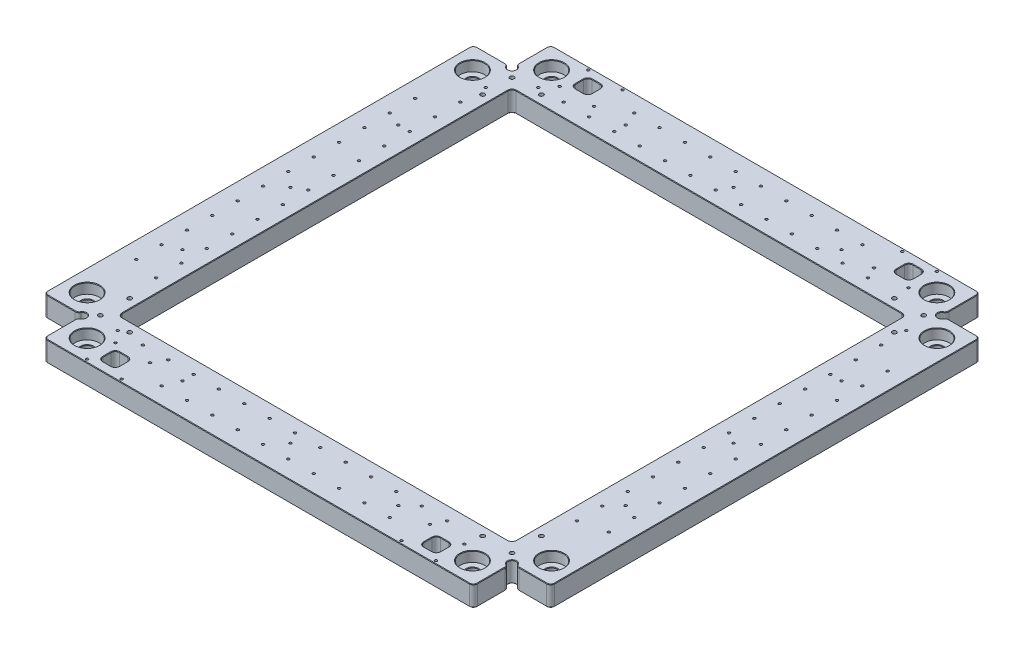
from build123d import *

# Parameters (mm, degrees)
SKETCH1_W                            = 500
SKETCH1_H                            = 500
BOSS_EXTRUDE1_DEPTH                  = 20
BEARING_PRESS_FIT_D                  = 11.8
CIRPATTERN1_COUNT                    = 4
SKETCH5_W                            = 388
SKETCH5_H                            = 388
CUT_EXTRUDE1_DEPTH                   = 20
SKETCH10_W                           = 428
SKETCH10_H                           = 428
SKETCH10_W_2                         = 403
SKETCH10_H_2                         = 403
LINEAR_RAIL_SLOT_DEPTH               = 2.5
FILLET2_R                            = 4
TAP_DRILL_FOR_M3X0_5_TAP1_D          = 2.5
MIRROR6_COPY_1_D                     = 2.5
BOSS_EXTRUDE2_DEPTH                  = 2.5
CIRPATTERN4_COUNT                    = 4
CUT_EXTRUDE3_DEPTH                   = 355.118624193
TAP_DRILL_FOR_M3X0_5_TAP6_D          = 2.5
MIRROR9_COPY_1_DEPTH                 = 355.118624193
MIRROR9_COPY_2_D                     = 2.5
SKETCH27_W                           = 38.1
SKETCH27_H                           = 38.1
CUT_EXTRUDE4_DEPTH                   = 20
SKETCH47_R                           = 4
CUT_EXTRUDE5_DEPTH                   = 20
TAP_DRILL_FOR_M5X0_8_TAP1_AT_2_COUNT = 2
TAP_DRILL_FOR_M5X0_8_TAP1_AT_2_PITCH = 29
TAP_DRILL_FOR_M5X0_8_TAP1_AT_3_COUNT = 2
TAP_DRILL_FOR_M5X0_8_TAP1_AT_3_PITCH = 41.012193309
TAP_DRILL_FOR_M3X0_5_TAP7_D          = 2.5
CUT_EXTRUDE6_DEPTH                   = 3.5
TAP_DRILL_FOR_M3X0_5_TAP9_D          = 2.5
LPATTERN1_COUNT                      = 3
LPATTERN1_PITCH                      = 106.5
CIRPATTERN3_COUNT                    = 4
CIRPATTERN3_COPY_7_DEPTH             = 3.5
CIRPATTERN3_COPY_8_DEPTH             = 3.5
CIRPATTERN3_COPY_9_DEPTH             = 3.5
CIRPATTERN3_COPY_10_DEPTH            = 3.5
CIRPATTERN3_COPY_11_DEPTH            = 3.5
CIRPATTERN3_COPY_12_DEPTH            = 3.5
CIRPATTERN3_COPY_13_D                = 2.5
CIRPATTERN3_COPY_14_D                = 2.5
CIRPATTERN3_COPY_15_D                = 2.5
CIRPATTERN3_COPY_16_D                = 2.5
CIRPATTERN3_COPY_17_D                = 2.5
CIRPATTERN3_COPY_18_D                = 2.5
FILLET8_R                            = 4
F_24_0_24_DIAMETER_HOLE1_D           = 24
F_24_0_24_DIAMETER_HOLE1_DEPTH       = 10
FILLET6_R                            = 4
TAP_DRILL_FOR_M3X0_5_TAP8_D          = 2.5
CHAMFER1_SIZE                        = 0.5


with BuildPart() as part:
    # Sketch1 → Boss-Extrude1 (new body)
    with BuildSketch(Plane(origin=(0, 0, 0), x_dir=(1, 0, 0), z_dir=(0, 1, 0))):
        Rectangle(SKETCH1_W, SKETCH1_H)
    extrude(amount=BOSS_EXTRUDE1_DEPTH)

    # Bearing Press Fit (through all)
    with Locations(Plane(origin=(0, 20, 0), x_dir=(1, 0, 0), z_dir=(0, 1, 0))):
        with Locations((-190, 229), (-229, 190)):
            bearing_press_fit = Hole(BEARING_PRESS_FIT_D / 2)

    # CirPattern1: Bearing Press Fit ×4 about axis
    cirpattern1_axis = Axis((0, 0, 0), (0, 1, 0))
    for i in range(1, CIRPATTERN1_COUNT):
        add(bearing_press_fit.rotate(cirpattern1_axis, i * 360 / CIRPATTERN1_COUNT), mode=Mode.SUBTRACT)

    # Sketch5 → Cut-Extrude1 (cut)
    with BuildSketch(Plane(origin=(0, 20, 0), x_dir=(1, 0, 0), z_dir=(0, 1, 0))):
        Rectangle(SKETCH5_W, SKETCH5_H)
    extrude(amount=-CUT_EXTRUDE1_DEPTH, mode=Mode.SUBTRACT)

    # Sketch10 → Linear Rail Slot (cut)
    with BuildSketch(Plane(origin=(0, 0, 0), x_dir=(1, 0, 0), z_dir=(0, 1, 0))):
        Rectangle(SKETCH10_W, SKETCH10_H)
        Rectangle(SKETCH10_W_2, SKETCH10_H_2, mode=Mode.SUBTRACT)
    extrude(amount=LINEAR_RAIL_SLOT_DEPTH, mode=Mode.SUBTRACT)

    # Fillet2
    fillet2_edges = [part.edges().sort_by_distance(p)[0] for p in [
        (-194, 10, 194),
        (-194, 10, -194),
        (194, 10, -194),
        (194, 10, 194),
    ]]
    fillet(fillet2_edges, radius=FILLET2_R)

    # Tap Drill for M3x0.5 Tap1 (through all)
    with Locations(Plane(origin=(0, 2.5, 0), x_dir=(-1, 0, 0), z_dir=(0, -1, 0))):
        with Locations((-143.5, -207.5), (-118.5, -207.5), (-93.5, -207.5), (-68.5, -207.5), (-43.5, -207.5), (-18.5, -207.5), (6.5, -207.5), (31.5, -207.5), (56.5, -207.5), (81.5, -207.5), (106.5, -207.5), (131.5, -207.5), (156.5, -207.5), (181.5, -207.5)):
            tap_drill_for_m3x0_5_tap1 = Hole(TAP_DRILL_FOR_M3X0_5_TAP1_D / 2)

    # Mirror5: Tap Drill for M3x0.5 Tap1 across plane
    add(tap_drill_for_m3x0_5_tap1.mirror(Plane.XY), mode=Mode.SUBTRACT)

    # Mirror6: Tap Drill for M3x0.5 Tap1 across plane
    add(tap_drill_for_m3x0_5_tap1.mirror(Plane(origin=(0, 0, 0), x_dir=(0.7071067811865478, 0, 0.7071067811865472), z_dir=(-0.7071067811865475, 0, 0.7071067811865477))), mode=Mode.SUBTRACT)

    # Mirror6 copy 1 (through all)
    with Locations(Plane(origin=(0, 2.5, 0), x_dir=(0, 0, -1), z_dir=(0, -1, 0))):
        with Locations((-143.5, -207.5), (-118.5, -207.5), (-93.5, -207.5), (-68.5, -207.5), (-43.5, -207.5), (-18.5, -207.5), (6.5, -207.5), (31.5, -207.5), (56.5, -207.5), (81.5, -207.5), (106.5, -207.5), (131.5, -207.5), (156.5, -207.5), (181.5, -207.5)):
            Hole(MIRROR6_COPY_1_D / 2)

    # Sketch19 → Boss-Extrude2 (add)
    with BuildSketch(Plane.XZ.offset(-2.5)):
        Polygon((-198.5, 201.5), (-198.5, 214), (-214, 214), (-214, 198.5), (-201.5, 198.5), (-201.5, 201.5), align=None)
    boss_extrude2 = extrude(amount=BOSS_EXTRUDE2_DEPTH)

    # CirPattern4: Boss-Extrude2 ×4 about axis
    cirpattern4_axis = Axis((0, 0, 0), (0, 1, 0))
    for i in range(1, CIRPATTERN4_COUNT):
        add(boss_extrude2.rotate(cirpattern4_axis, i * 360 / CIRPATTERN4_COUNT))

    # Sketch20 → Cut-Extrude3 (cut, through all)
    with BuildSketch(Plane(origin=(0, 20, 0), x_dir=(1, 0, 0), z_dir=(0, 1, 0))):
        with BuildLine():
            Line((162.3, -241), (154.3, -241))
            ThreePointArc((154.3, -241), (151.471572875, -239.828427125), (150.3, -237))
            Line((150.3, -237), (150.3, -229))
            ThreePointArc((150.3, -229), (151.471572875, -226.171572875), (154.3, -225))
            Line((154.3, -225), (162.3, -225))
            ThreePointArc((162.3, -225), (165.128427125, -226.171572875), (166.3, -229))
            Line((166.3, -229), (166.3, -237))
            ThreePointArc((166.3, -237), (165.128427125, -239.828427125), (162.3, -241))
        make_face()
    cut_extrude3 = extrude(amount=-CUT_EXTRUDE3_DEPTH, mode=Mode.SUBTRACT)

    # Tap Drill for M3x0.5 Tap6 (through all)
    with Locations(Plane(origin=(0, 20, 0), x_dir=(1, 0, 0), z_dir=(0, 1, 0))):
        with Locations((172, -247), (138, -219), (172, -219), (138, -247)):
            tap_drill_for_m3x0_5_tap6 = Hole(TAP_DRILL_FOR_M3X0_5_TAP6_D / 2)

    # Mirror8: Cut-Extrude3, Tap Drill for M3x0.5 Tap6 across plane
    add(cut_extrude3.mirror(Plane(origin=(0, 0, 0), x_dir=(0, 0, 1), z_dir=(1, 0, 0))), mode=Mode.SUBTRACT)
    add(tap_drill_for_m3x0_5_tap6.mirror(Plane(origin=(0, 0, 0), x_dir=(0, 0, 1), z_dir=(1, 0, 0))), mode=Mode.SUBTRACT)

    # Mirror9: Cut-Extrude3, Tap Drill for M3x0.5 Tap6 across plane
    add(cut_extrude3.mirror(Plane.XY), mode=Mode.SUBTRACT)
    add(tap_drill_for_m3x0_5_tap6.mirror(Plane.XY), mode=Mode.SUBTRACT)

    # Mirror9 copy 1 sketch → Mirror9 copy 1 (cut, through all)
    with BuildSketch(Plane(origin=(0, 20, 0), x_dir=(-1, 0, 0), z_dir=(0, 1, 0))):
        with BuildLine():
            Line((162.3, -241), (154.3, -241))
            ThreePointArc((154.3, -241), (151.471572875, -239.828427125), (150.3, -237))
            Line((150.3, -237), (150.3, -229))
            ThreePointArc((150.3, -229), (151.471572875, -226.171572875), (154.3, -225))
            Line((154.3, -225), (162.3, -225))
            ThreePointArc((162.3, -225), (165.128427125, -226.171572875), (166.3, -229))
            Line((166.3, -229), (166.3, -237))
            ThreePointArc((166.3, -237), (165.128427125, -239.828427125), (162.3, -241))
        make_face()
    extrude(amount=-MIRROR9_COPY_1_DEPTH, mode=Mode.SUBTRACT)

    # Mirror9 copy 2 (through all)
    with Locations(Plane(origin=(0, 20, 0), x_dir=(-1, 0, 0), z_dir=(0, 1, 0))):
        with Locations((172, -247), (138, -219), (172, -219), (138, -247)):
            Hole(MIRROR9_COPY_2_D / 2)

    # Sketch27 → Cut-Extrude4 (cut)
    with BuildSketch(Plane(origin=(0, 20, 0), x_dir=(1, 0, 0), z_dir=(0, 1, 0))):
        with Locations((230.95, -230.95)):
            Rectangle(SKETCH27_W, SKETCH27_H)
    cut_extrude4 = extrude(amount=-CUT_EXTRUDE4_DEPTH, mode=Mode.SUBTRACT)

    # Sketch47 → Cut-Extrude5 (cut)
    with BuildSketch(Plane.XZ):
        with Locations((211.9, 211.9)):
            Circle(SKETCH47_R)
    cut_extrude5 = extrude(amount=-CUT_EXTRUDE5_DEPTH, mode=Mode.SUBTRACT)

    # Sketch49 → Tap Drill for M5x0.8 Tap1 (revolve, cut)
    with BuildSketch(Plane(origin=(174, 20, 203), x_dir=(0, 0, 1), z_dir=(1, 0, 0))):
        Polygon((0, 0), (0, 11.2618073), (2.1, 10), (2.1, 0), align=None)
    tap_drill_for_m5x0_8_tap1 = revolve(axis=Axis((174, 26.35, 203), (0, -1, 0)), mode=Mode.SUBTRACT)

    # Tap Drill for M5x0.8 Tap1 at 2: Tap Drill for M5x0.8 Tap1 ×2
    with Locations(*[(i * TAP_DRILL_FOR_M5X0_8_TAP1_AT_2_PITCH, 0, 0) for i in range(1, TAP_DRILL_FOR_M5X0_8_TAP1_AT_2_COUNT)]):
        add(tap_drill_for_m5x0_8_tap1, mode=Mode.SUBTRACT)

    # Tap Drill for M5x0.8 Tap1 at 3: Tap Drill for M5x0.8 Tap1 ×2
    with Locations(*[Vector(0.7071067811865479, 0, -0.7071067811865472) * (i * TAP_DRILL_FOR_M5X0_8_TAP1_AT_3_PITCH) for i in range(1, TAP_DRILL_FOR_M5X0_8_TAP1_AT_3_COUNT)]):
        add(tap_drill_for_m5x0_8_tap1, mode=Mode.SUBTRACT)

    # Tap Drill for M3x0.5 Tap7 (through all)
    with Locations(Plane(origin=(0, 0, 0), x_dir=(-1, 0, 0), z_dir=(0, -1, 0))):
        with Locations((-112.5, -233), (-87.5, -233), (-62.5, -233), (-37.5, -233), (-12.5, -233), (12.5, -233), (37.5, -233), (62.5, -233), (87.5, -233), (112.5, -233)):
            tap_drill_for_m3x0_5_tap7 = Hole(TAP_DRILL_FOR_M3X0_5_TAP7_D / 2)

    # Sketch59 → Cut-Extrude6 (cut)
    with BuildSketch(Plane.XZ):
        with BuildLine():
            Line((-94, 213.5), (-119, 213.5))
            ThreePointArc((-119, 213.5), (-121.828427125, 214.671572875), (-123, 217.5))
            Line((-123, 217.5), (-123, 219.5))
            ThreePointArc((-123, 219.5), (-121.828427125, 222.328427125), (-119, 223.5))
            Line((-119, 223.5), (-94, 223.5))
            ThreePointArc((-94, 223.5), (-91.171572875, 222.328427125), (-90, 219.5))
            Line((-90, 219.5), (-90, 217.5))
            ThreePointArc((-90, 217.5), (-91.171572875, 214.671572875), (-94, 213.5))
        make_face()
    cut_extrude6 = extrude(amount=-CUT_EXTRUDE6_DEPTH, mode=Mode.SUBTRACT)

    # Tap Drill for M3x0.5 Tap9 (through all)
    with Locations(Plane(origin=(0, 3.5, 0), x_dir=(-1, 0, 0), z_dir=(0, -1, 0))):
        with Locations((106.5, -218.5)):
            tap_drill_for_m3x0_5_tap9 = Hole(TAP_DRILL_FOR_M3X0_5_TAP9_D / 2)

    # LPattern1: Cut-Extrude6, Tap Drill for M3x0.5 Tap9 ×3
    with Locations(*[(i * LPATTERN1_PITCH, 0, 0) for i in range(1, LPATTERN1_COUNT)]):
        add(cut_extrude6, mode=Mode.SUBTRACT)
        add(tap_drill_for_m3x0_5_tap9, mode=Mode.SUBTRACT)

    # CirPattern3: Cut-Extrude4, Cut-Extrude5, Tap Drill for M5x0.8 Tap1, Tap Drill for M3x0.5 Tap7, Cut-Extrude6, Tap Drill for M3x0.5 Tap9 ×4 about axis
    cirpattern3_axis = Axis((0, 0, 0), (0, 1, 0))
    add([cut_extrude4.rotate(cirpattern3_axis, i * 360 / CIRPATTERN3_COUNT) for i in range(1, CIRPATTERN3_COUNT)], mode=Mode.SUBTRACT)
    add([cut_extrude5.rotate(cirpattern3_axis, i * 360 / CIRPATTERN3_COUNT) for i in range(1, CIRPATTERN3_COUNT)], mode=Mode.SUBTRACT)
    add([tap_drill_for_m5x0_8_tap1.rotate(cirpattern3_axis, i * 360 / CIRPATTERN3_COUNT) for i in range(1, CIRPATTERN3_COUNT)], mode=Mode.SUBTRACT)
    add([tap_drill_for_m3x0_5_tap7.rotate(cirpattern3_axis, i * 360 / CIRPATTERN3_COUNT) for i in range(1, CIRPATTERN3_COUNT)], mode=Mode.SUBTRACT)
    add([cut_extrude6.rotate(cirpattern3_axis, i * 360 / CIRPATTERN3_COUNT) for i in range(1, CIRPATTERN3_COUNT)], mode=Mode.SUBTRACT)
    add([tap_drill_for_m3x0_5_tap9.rotate(cirpattern3_axis, i * 360 / CIRPATTERN3_COUNT) for i in range(1, CIRPATTERN3_COUNT)], mode=Mode.SUBTRACT)

    # CirPattern3 copy 1 sketch → CirPattern3 copy 1 (revolve, cut)
    with BuildSketch(Plane(origin=(203, 20, -203), x_dir=(1, 0, 0), z_dir=(0, 0, -1))):
        Polygon((0, 0), (0, 11.2618073), (2.1, 10), (2.1, 0), align=None)
    revolve(axis=Axis((203, 26.35, -203), (0, -1, 0)), mode=Mode.SUBTRACT)

    # CirPattern3 copy 2 sketch → CirPattern3 copy 2 (revolve, cut)
    with BuildSketch(Plane(origin=(-203, 20, -203), x_dir=(0, 0, -1), z_dir=(-1, 0, 0))):
        Polygon((0, 0), (0, 11.2618073), (2.1, 10), (2.1, 0), align=None)
    revolve(axis=Axis((-203, 26.35, -203), (0, -1, 0)), mode=Mode.SUBTRACT)

    # CirPattern3 copy 3 sketch → CirPattern3 copy 3 (revolve, cut)
    with BuildSketch(Plane(origin=(-203, 20, 203), x_dir=(-1, 0, 0), z_dir=(0, 0, 1))):
        Polygon((0, 0), (0, 11.2618073), (2.1, 10), (2.1, 0), align=None)
    revolve(axis=Axis((-203, 26.35, 203), (0, -1, 0)), mode=Mode.SUBTRACT)

    # CirPattern3 copy 4 sketch → CirPattern3 copy 4 (revolve, cut)
    with BuildSketch(Plane(origin=(174, 20, -203), x_dir=(1, 0, 0), z_dir=(0, 0, -1))):
        Polygon((0, 0), (0, 11.2618073), (2.1, 10), (2.1, 0), align=None)
    revolve(axis=Axis((174, 26.35, -203), (0, -1, 0)), mode=Mode.SUBTRACT)

    # CirPattern3 copy 5 sketch → CirPattern3 copy 5 (revolve, cut)
    with BuildSketch(Plane(origin=(-203, 20, -174), x_dir=(0, 0, -1), z_dir=(-1, 0, 0))):
        Polygon((0, 0), (0, 11.2618073), (2.1, 10), (2.1, 0), align=None)
    revolve(axis=Axis((-203, 26.35, -174), (0, -1, 0)), mode=Mode.SUBTRACT)

    # CirPattern3 copy 6 sketch → CirPattern3 copy 6 (revolve, cut)
    with BuildSketch(Plane(origin=(-174, 20, 203), x_dir=(-1, 0, 0), z_dir=(0, 0, 1))):
        Polygon((0, 0), (0, 11.2618073), (2.1, 10), (2.1, 0), align=None)
    revolve(axis=Axis((-174, 26.35, 203), (0, -1, 0)), mode=Mode.SUBTRACT)

    # CirPattern3 copy 7 sketch → CirPattern3 copy 7 (cut)
    with BuildSketch(Plane(origin=(0, 0, -106.5), x_dir=(0, 0, -1), z_dir=(0, -1, 0))):
        with BuildLine():
            Line((-94, 213.5), (-119, 213.5))
            ThreePointArc((-119, 213.5), (-121.828427125, 214.671572875), (-123, 217.5))
            Line((-123, 217.5), (-123, 219.5))
            ThreePointArc((-123, 219.5), (-121.828427125, 222.328427125), (-119, 223.5))
            Line((-119, 223.5), (-94, 223.5))
            ThreePointArc((-94, 223.5), (-91.171572875, 222.328427125), (-90, 219.5))
            Line((-90, 219.5), (-90, 217.5))
            ThreePointArc((-90, 217.5), (-91.171572875, 214.671572875), (-94, 213.5))
        make_face()
    extrude(amount=-CIRPATTERN3_COPY_7_DEPTH, mode=Mode.SUBTRACT)

    # CirPattern3 copy 8 sketch → CirPattern3 copy 8 (cut)
    with BuildSketch(Plane(origin=(-106.5, 0, 0), x_dir=(-1, 0, 0), z_dir=(0, -1, 0))):
        with BuildLine():
            Line((-94, 213.5), (-119, 213.5))
            ThreePointArc((-119, 213.5), (-121.828427125, 214.671572875), (-123, 217.5))
            Line((-123, 217.5), (-123, 219.5))
            ThreePointArc((-123, 219.5), (-121.828427125, 222.328427125), (-119, 223.5))
            Line((-119, 223.5), (-94, 223.5))
            ThreePointArc((-94, 223.5), (-91.171572875, 222.328427125), (-90, 219.5))
            Line((-90, 219.5), (-90, 217.5))
            ThreePointArc((-90, 217.5), (-91.171572875, 214.671572875), (-94, 213.5))
        make_face()
    extrude(amount=-CIRPATTERN3_COPY_8_DEPTH, mode=Mode.SUBTRACT)

    # CirPattern3 copy 9 sketch → CirPattern3 copy 9 (cut)
    with BuildSketch(Plane(origin=(0, 0, 106.5), x_dir=(0, 0, 1), z_dir=(0, -1, 0))):
        with BuildLine():
            Line((-94, 213.5), (-119, 213.5))
            ThreePointArc((-119, 213.5), (-121.828427125, 214.671572875), (-123, 217.5))
            Line((-123, 217.5), (-123, 219.5))
            ThreePointArc((-123, 219.5), (-121.828427125, 222.328427125), (-119, 223.5))
            Line((-119, 223.5), (-94, 223.5))
            ThreePointArc((-94, 223.5), (-91.171572875, 222.328427125), (-90, 219.5))
            Line((-90, 219.5), (-90, 217.5))
            ThreePointArc((-90, 217.5), (-91.171572875, 214.671572875), (-94, 213.5))
        make_face()
    extrude(amount=-CIRPATTERN3_COPY_9_DEPTH, mode=Mode.SUBTRACT)

    # CirPattern3 copy 10 sketch → CirPattern3 copy 10 (cut)
    with BuildSketch(Plane(origin=(0, 0, -213), x_dir=(0, 0, -1), z_dir=(0, -1, 0))):
        with BuildLine():
            Line((-94, 213.5), (-119, 213.5))
            ThreePointArc((-119, 213.5), (-121.828427125, 214.671572875), (-123, 217.5))
            Line((-123, 217.5), (-123, 219.5))
            ThreePointArc((-123, 219.5), (-121.828427125, 222.328427125), (-119, 223.5))
            Line((-119, 223.5), (-94, 223.5))
            ThreePointArc((-94, 223.5), (-91.171572875, 222.328427125), (-90, 219.5))
            Line((-90, 219.5), (-90, 217.5))
            ThreePointArc((-90, 217.5), (-91.171572875, 214.671572875), (-94, 213.5))
        make_face()
    extrude(amount=-CIRPATTERN3_COPY_10_DEPTH, mode=Mode.SUBTRACT)

    # CirPattern3 copy 11 sketch → CirPattern3 copy 11 (cut)
    with BuildSketch(Plane(origin=(-213, 0, 0), x_dir=(-1, 0, 0), z_dir=(0, -1, 0))):
        with BuildLine():
            Line((-94, 213.5), (-119, 213.5))
            ThreePointArc((-119, 213.5), (-121.828427125, 214.671572875), (-123, 217.5))
            Line((-123, 217.5), (-123, 219.5))
            ThreePointArc((-123, 219.5), (-121.828427125, 222.328427125), (-119, 223.5))
            Line((-119, 223.5), (-94, 223.5))
            ThreePointArc((-94, 223.5), (-91.171572875, 222.328427125), (-90, 219.5))
            Line((-90, 219.5), (-90, 217.5))
            ThreePointArc((-90, 217.5), (-91.171572875, 214.671572875), (-94, 213.5))
        make_face()
    extrude(amount=-CIRPATTERN3_COPY_11_DEPTH, mode=Mode.SUBTRACT)

    # CirPattern3 copy 12 sketch → CirPattern3 copy 12 (cut)
    with BuildSketch(Plane(origin=(0, 0, 213), x_dir=(0, 0, 1), z_dir=(0, -1, 0))):
        with BuildLine():
            Line((-94, 213.5), (-119, 213.5))
            ThreePointArc((-119, 213.5), (-121.828427125, 214.671572875), (-123, 217.5))
            Line((-123, 217.5), (-123, 219.5))
            ThreePointArc((-123, 219.5), (-121.828427125, 222.328427125), (-119, 223.5))
            Line((-119, 223.5), (-94, 223.5))
            ThreePointArc((-94, 223.5), (-91.171572875, 222.328427125), (-90, 219.5))
            Line((-90, 219.5), (-90, 217.5))
            ThreePointArc((-90, 217.5), (-91.171572875, 214.671572875), (-94, 213.5))
        make_face()
    extrude(amount=-CIRPATTERN3_COPY_12_DEPTH, mode=Mode.SUBTRACT)

    # CirPattern3 copy 13 (through all)
    with Locations(Plane(origin=(0, 3.5, -106.5), x_dir=(0, 0, 1), z_dir=(0, -1, 0))):
        with Locations((106.5, -218.5)):
            Hole(CIRPATTERN3_COPY_13_D / 2)

    # CirPattern3 copy 14 (through all)
    with Locations(Plane(origin=(-106.5, 3.5, 0), x_dir=(1, 0, 0), z_dir=(0, -1, 0))):
        with Locations((106.5, -218.5)):
            Hole(CIRPATTERN3_COPY_14_D / 2)

    # CirPattern3 copy 15 (through all)
    with Locations(Plane(origin=(0, 3.5, 106.5), x_dir=(0, 0, -1), z_dir=(0, -1, 0))):
        with Locations((106.5, -218.5)):
            Hole(CIRPATTERN3_COPY_15_D / 2)

    # CirPattern3 copy 16 (through all)
    with Locations(Plane(origin=(0, 3.5, -213), x_dir=(0, 0, 1), z_dir=(0, -1, 0))):
        with Locations((106.5, -218.5)):
            Hole(CIRPATTERN3_COPY_16_D / 2)

    # CirPattern3 copy 17 (through all)
    with Locations(Plane(origin=(-213, 3.5, 0), x_dir=(1, 0, 0), z_dir=(0, -1, 0))):
        with Locations((106.5, -218.5)):
            Hole(CIRPATTERN3_COPY_17_D / 2)

    # CirPattern3 copy 18 (through all)
    with Locations(Plane(origin=(0, 3.5, 213), x_dir=(0, 0, -1), z_dir=(0, -1, 0))):
        with Locations((106.5, -218.5)):
            Hole(CIRPATTERN3_COPY_18_D / 2)

    # Fillet8
    # the kernel refuses this fillet: 4 mm, written as the material it adds along each edge
    with BuildSketch(Plane(origin=(198.5, 12.5, 214), x_dir=(-1, 0, 0), z_dir=(0, -1, 0)), Plane(origin=(198.5, 12.5, 201.5), x_dir=(0, 0, 1), z_dir=(0, -1, 0)), Plane(origin=(-198.5, 12.5, 201.5), x_dir=(1, 0, 0), z_dir=(0, -1, 0)), Plane(origin=(-198.5, 12.5, 214), x_dir=(0, 0, -1), z_dir=(0, -1, 0)), Plane(origin=(-214, 12.5, 198.5), x_dir=(0, 0, -1), z_dir=(0, -1, 0)), Plane(origin=(198.5, 12.5, -214), x_dir=(0, 0, 1), z_dir=(0, -1, 0)), Plane(origin=(198.5, 12.5, -201.5), x_dir=(-1, 0, 0), z_dir=(0, -1, 0)), Plane(origin=(-198.5, 12.5, -201.5), x_dir=(0, 0, -1), z_dir=(0, -1, 0)), Plane(origin=(-198.5, 12.5, -214), x_dir=(1, 0, 0), z_dir=(0, -1, 0)), Plane(origin=(214, 12.5, -198.5), x_dir=(0, 0, 1), z_dir=(0, -1, 0)), Plane(origin=(214, 12.5, 198.5), x_dir=(-1, 0, 0), z_dir=(0, -1, 0)), Plane(origin=(201.5, 12.5, -198.5), x_dir=(1, 0, 0), z_dir=(0, -1, 0)), Plane(origin=(201.5, 12.5, 198.5), x_dir=(0, 0, -1), z_dir=(0, -1, 0))) as fillet8_piece_1:
        with BuildLine():
            CenterArc((FILLET8_R, FILLET8_R), FILLET8_R, 180, 90)
            Line((0, FILLET8_R), (0, 0))
            Line((0, 0), (FILLET8_R, 0))
        make_face()
    extrude(amount=12.5)
    with BuildSketch(Plane(origin=(-214, 12.5, -198.5), x_dir=(0, 0, 1), z_dir=(0, -1, 0)), Plane(origin=(-201.5, 12.5, -198.5), x_dir=(-1, 0, 0), z_dir=(0, -1, 0)), Plane(origin=(-201.5, 12.5, 198.5), x_dir=(0, 0, -1), z_dir=(0, -1, 0))) as fillet8_piece_2:
        with BuildLine():
            CenterArc((FILLET8_R, -FILLET8_R), FILLET8_R, 90, 90)
            Line((0, -FILLET8_R), (0, 0))
            Line((0, 0), (FILLET8_R, 0))
        make_face()
    extrude(amount=12.5)
    # the kernel refuses this fillet: 4 mm, written as the material it takes off along each edge
    with BuildSketch(Plane(origin=(92.063508327, 2.5, 214), x_dir=(-0.45846609977039576, 0, 0.8887118967141835), z_dir=(0, -1, 0)), Plane(origin=(-214, 2.5, 92.063508327), x_dir=(-0.8887118967141423, 0, -0.45846609977047553), z_dir=(0, -1, 0)), Plane(origin=(-214, 2.5, -14.436491673), x_dir=(-0.8887118967141467, 0, -0.4584660997704671), z_dir=(0, -1, 0)), Plane(origin=(-214, 2.5, -120.936491673), x_dir=(-0.8887118967141462, 0, -0.45846609977046804), z_dir=(0, -1, 0)), Plane(origin=(-92.063508327, 2.5, -214), x_dir=(0.45846609977035085, 0, -0.8887118967142067), z_dir=(0, -1, 0)), Plane(origin=(214, 2.5, -92.063508327), x_dir=(0.888711896714244, 0, 0.4584660997702786), z_dir=(0, -1, 0))) as fillet8_2_piece_1:
        with BuildLine():
            CenterArc((6.3347606, 3.554847587), FILLET8_R, 152.711828063, 90)
            Line((2.779913014, 5.388711986), (2.424428255, 5.572098426))
            Line((2.424428255, 5.572098426), (-0.355484759, 0.18338644))
            Line((-0.355484759, 0.18338644), (0.222267585, -0.332561454))
            ThreePointArc((0.222267585, -0.332561454), (3.873153813, -0.126251709), (4.317509761, -0.355484759))
            Line((4.317509761, -0.355484759), (4.500896201, 0))
        make_face()
    extrude(amount=17.658770817, mode=Mode.SUBTRACT)
    with BuildSketch(Plane(origin=(-120.936491673, 2.5, 214), x_dir=(-1, 0, 0), z_dir=(0, -1, 0)), Plane(origin=(-14.436491673, 2.5, 214), x_dir=(-1, 0, 0), z_dir=(0, -1, 0)), Plane(origin=(14.436491673, 2.5, -214), x_dir=(1, 0, 0), z_dir=(0, -1, 0)), Plane(origin=(120.936491673, 2.5, -214), x_dir=(1, 0, 0), z_dir=(0, -1, 0)), Plane(origin=(214, 2.5, 14.436491673), x_dir=(0, 0, 1), z_dir=(0, -1, 0)), Plane(origin=(214, 2.5, 120.936491673), x_dir=(0, 0, 1), z_dir=(0, -1, 0))) as fillet8_2_piece_2:
        with BuildLine():
            CenterArc((6.063508327, -4), FILLET8_R, 90, 90)
            Line((2.063508327, -4), (1.663508327, -4))
            ThreePointArc((1.663508327, -4), (1.663508327, -3.5), (-0.193649167, -0.35))
            Line((-0.193649167, -0.35), (0, 0.4))
            Line((0, 0.4), (6.063508327, 0.4))
            Line((6.063508327, 0.4), (6.063508327, 0))
        make_face()
    extrude(amount=17.658770817, mode=Mode.SUBTRACT)
    with BuildSketch(Plane(origin=(-92.063508327, 2.5, 214), x_dir=(0.45846609977039576, 0, 0.8887118967141835), z_dir=(0, -1, 0)), Plane(origin=(92.063508327, 2.5, -214), x_dir=(-0.45846609977035085, 0, -0.8887118967142067), z_dir=(0, -1, 0)), Plane(origin=(214, 2.5, 92.063508327), x_dir=(0.888711896714244, 0, -0.4584660997702786), z_dir=(0, -1, 0))) as fillet8_2_piece_3:
        with BuildLine():
            CenterArc((6.3347606, -3.554847587), FILLET8_R, 117.288171937, 90)
            Line((2.779913014, -5.388711986), (2.424428255, -5.572098426))
            Line((2.424428255, -5.572098426), (-0.355484759, -0.18338644))
            Line((-0.355484759, -0.18338644), (0.222267585, 0.332561454))
            ThreePointArc((0.222267585, 0.332561454), (3.873153813, 0.126251709), (4.317509761, 0.355484759))
            Line((4.317509761, 0.355484759), (4.500896201, 0))
        make_face()
    extrude(amount=17.658770817, mode=Mode.SUBTRACT)
    with BuildSketch(Plane(origin=(14.436491673, 2.5, 214), x_dir=(1, 0, 0), z_dir=(0, -1, 0)), Plane(origin=(120.936491673, 2.5, 214), x_dir=(1, 0, 0), z_dir=(0, -1, 0)), Plane(origin=(-214, 2.5, 120.936491673), x_dir=(0, 0, 1), z_dir=(0, -1, 0)), Plane(origin=(-214, 2.5, 14.436491673), x_dir=(0, 0, 1), z_dir=(0, -1, 0)), Plane(origin=(-214, 2.5, -92.063508327), x_dir=(0, 0, 1), z_dir=(0, -1, 0)), Plane(origin=(-120.936491673, 2.5, -214), x_dir=(-1, 0, 0), z_dir=(0, -1, 0)), Plane(origin=(-14.436491673, 2.5, -214), x_dir=(-1, 0, 0), z_dir=(0, -1, 0)), Plane(origin=(214, 2.5, -120.936491673), x_dir=(0, 0, -1), z_dir=(0, -1, 0)), Plane(origin=(214, 2.5, -14.436491673), x_dir=(0, 0, -1), z_dir=(0, -1, 0))) as fillet8_2_piece_4:
        with BuildLine():
            CenterArc((6.063508327, 4), FILLET8_R, 180, 90)
            Line((2.063508327, 4), (1.663508327, 4))
            ThreePointArc((1.663508327, 4), (1.663508327, 3.5), (-0.193649167, 0.35))
            Line((-0.193649167, 0.35), (0, -0.4))
            Line((0, -0.4), (6.063508327, -0.4))
            Line((6.063508327, -0.4), (6.063508327, 0))
        make_face()
    extrude(amount=17.658770817, mode=Mode.SUBTRACT)

    # Ø24.0 (24) Diameter Hole1
    with Locations(Plane(origin=(0, 20, 0), x_dir=(1, 0, 0), z_dir=(0, 1, 0))):
        with Locations((-229, -190), (-190, -229), (190, -229), (229, -190), (229, 190), (190, 229), (-190, 229), (-229, 190)):
            Hole(F_24_0_24_DIAMETER_HOLE1_D / 2, depth=F_24_0_24_DIAMETER_HOLE1_DEPTH)

    # Fillet6
    fillet6_edges = [part.edges().sort_by_distance(p)[0] for p in [
        (-211.9, 10, 250),
        (-250, 10, 211.9),
        (-250, 10, -211.9),
        (-211.9, 10, -250),
        (211.9, 10, -250),
        (250, 10, -211.9),
        (-211.9, 10, 215.9),
        (-215.9, 10, -211.9),
        (211.9, 10, -215.9),
        (-215.9, 10, 211.9),
        (-211.9, 10, -215.9),
        (215.9, 10, -211.9),
        (250, 10, 211.9),
        (211.9, 10, 250),
        (215.9, 10, 211.9),
        (211.9, 10, 215.9),
    ]]
    fillet(fillet6_edges, radius=FILLET6_R)

    # Tap Drill for M3x0.5 Tap8 (through all)
    with Locations(Plane(origin=(0, 0, 0), x_dir=(-1, 0, 0), z_dir=(0, -1, 0))):
        with Locations((-233, 137.5), (233, 137.5), (233, -137.5), (-233, -137.5), (-233, 62.5)):
            Hole(TAP_DRILL_FOR_M3X0_5_TAP8_D / 2)

    # Chamfer1
    chamfer1_edges = [part.edges().sort_by_distance(p)[0] for p in [
        (-194, 0, 0),
        (-194, 20, 0),
        (194, 0, 0),
        (194, 20, 0),
        (0, 0, -194),
        (0, 20, -194),
        (-192.828427125, 20, 192.828427125),
        (-192.828427125, 0, 192.828427125),
        (192.828427125, 20, 192.828427125),
        (192.828427125, 0, 192.828427125),
        (192.828427125, 20, -192.828427125),
        (192.828427125, 0, -192.828427125),
        (-192.828427125, 20, -192.828427125),
        (-192.828427125, 0, -192.828427125),
        (-223.1, 0, -190),
        (-184.1, 0, -229),
        (-223.1, 10, -190),
        (-217, 20, -190),
        (-184.1, 10, -229),
        (-178, 20, -229),
        (190, 10, -223.1),
        (202, 20, -229),
        (229, 10, -184.1),
        (241, 20, -190),
        (223.1, 10, 190),
        (241, 20, 190),
        (184.1, 10, 229),
        (202, 20, 229),
        (-190, 10, 223.1),
        (-178, 20, 229),
        (-229, 10, 184.1),
        (-217, 20, 190),
        (-232.414101615, 0, 211.9),
        (-232.414101615, 20, 211.9),
        (-209.071572875, 20, 209.071572875),
        (-211.9, 20, 232.414101615),
        (0, 20, 250),
        (211.9, 20, 232.414101615),
        (209.071572875, 20, 209.071572875),
        (232.414101615, 20, 211.9),
        (250, 20, 0),
        (232.414101615, 20, -211.9),
        (209.071572875, 20, -209.071572875),
        (211.9, 20, -232.414101615),
        (0, 20, -250),
        (-211.9, 20, -232.414101615),
        (-209.071572875, 20, -209.071572875),
        (-232.414101615, 20, -211.9),
        (-250, 20, 0),
        (216.82820323, 20, 211.364101615),
        (-211.364101615, 20, 216.82820323),
        (-210.728427125, 20, 248.828427125),
        (210.728427125, 20, 248.828427125),
        (211.364101615, 20, 216.82820323),
        (248.828427125, 20, 210.728427125),
        (248.828427125, 20, -210.728427125),
        (216.82820323, 20, -211.364101615),
        (211.364101615, 20, -216.82820323),
        (210.728427125, 20, -248.828427125),
        (-210.728427125, 20, -248.828427125),
        (-211.364101615, 20, -216.82820323),
        (-216.82820323, 20, -211.364101615),
        (-248.828427125, 20, -210.728427125),
        (-248.828427125, 20, 210.728427125),
        (-216.82820323, 20, 211.364101615),
        (-209.071572875, 0, 209.071572875),
        (-211.9, 0, 232.414101615),
        (-250, 0, 0),
        (-232.414101615, 0, -211.9),
        (-209.071572875, 0, -209.071572875),
        (-211.9, 0, -232.414101615),
        (0, 0, -250),
        (211.9, 0, -232.414101615),
        (209.071572875, 0, -209.071572875),
        (232.414101615, 0, -211.9),
        (250, 0, 0),
        (232.414101615, 0, 211.9),
        (209.071572875, 0, 209.071572875),
        (211.9, 0, 232.414101615),
        (0, 0, 250),
        (216.82820323, 0, 211.364101615),
        (-211.364101615, 0, 216.82820323),
        (-210.728427125, 0, 248.828427125),
        (210.728427125, 0, 248.828427125),
        (211.364101615, 0, 216.82820323),
        (248.828427125, 0, 210.728427125),
        (248.828427125, 0, -210.728427125),
        (216.82820323, 0, -211.364101615),
        (211.364101615, 0, -216.82820323),
        (210.728427125, 0, -248.828427125),
        (-210.728427125, 0, -248.828427125),
        (-211.364101615, 0, -216.82820323),
        (-216.82820323, 0, -211.364101615),
        (-248.828427125, 0, -210.728427125),
        (-248.828427125, 0, 210.728427125),
        (-216.82820323, 0, 211.364101615),
        (190, 0, -223.1),
        (229, 0, -184.1),
        (223.1, 0, 190),
        (184.1, 0, 229),
        (-190, 0, 223.1),
        (-229, 0, 184.1),
        (151.471572875, 0, 226.171572875),
        (158.3, 0, 225),
        (165.128427125, 0, 226.171572875),
        (166.3, 0, 233),
        (165.128427125, 0, 239.828427125),
        (158.3, 0, 241),
        (151.471572875, 0, 239.828427125),
        (150.3, 0, 233),
        (151.471572875, 20, 226.171572875),
        (150.3, 20, 233),
        (151.471572875, 20, 239.828427125),
        (158.3, 20, 241),
        (165.128427125, 20, 239.828427125),
        (166.3, 20, 233),
        (165.128427125, 20, 226.171572875),
        (158.3, 20, 225),
        (-151.471572875, 20, 226.171572875),
        (-150.3, 20, 233),
        (-151.471572875, 20, 239.828427125),
        (-158.3, 20, 241),
        (-165.128427125, 20, 239.828427125),
        (-166.3, 20, 233),
        (-165.128427125, 20, 226.171572875),
        (-158.3, 20, 225),
        (-151.471572875, 0, 226.171572875),
        (-150.3, 0, 233),
        (-151.471572875, 0, 239.828427125),
        (-158.3, 0, 241),
        (-165.128427125, 0, 239.828427125),
        (-166.3, 0, 233),
        (-165.128427125, 0, 226.171572875),
        (-158.3, 0, 225),
        (-151.471572875, 0, -226.171572875),
        (-158.3, 0, -225),
        (-165.128427125, 0, -226.171572875),
        (-166.3, 0, -233),
        (-165.128427125, 0, -239.828427125),
        (-158.3, 0, -241),
        (-151.471572875, 0, -239.828427125),
        (-150.3, 0, -233),
        (-151.471572875, 20, -226.171572875),
        (-150.3, 20, -233),
        (-151.471572875, 20, -239.828427125),
        (-158.3, 20, -241),
        (-165.128427125, 20, -239.828427125),
        (-166.3, 20, -233),
        (-165.128427125, 20, -226.171572875),
        (-158.3, 20, -225),
        (151.471572875, 20, -226.171572875),
        (150.3, 20, -233),
        (151.471572875, 20, -239.828427125),
        (158.3, 20, -241),
        (165.128427125, 20, -239.828427125),
        (166.3, 20, -233),
        (165.128427125, 20, -226.171572875),
        (158.3, 20, -225),
        (151.471572875, 0, -226.171572875),
        (150.3, 0, -233),
        (151.471572875, 0, -239.828427125),
        (158.3, 0, -241),
        (165.128427125, 0, -239.828427125),
        (166.3, 0, -233),
        (165.128427125, 0, -226.171572875),
        (158.3, 0, -225),
        (0, 0, 194),
        (0, 20, 194),
    ]]
    chamfer(chamfer1_edges, length=CHAMFER1_SIZE)


solid = part.part
